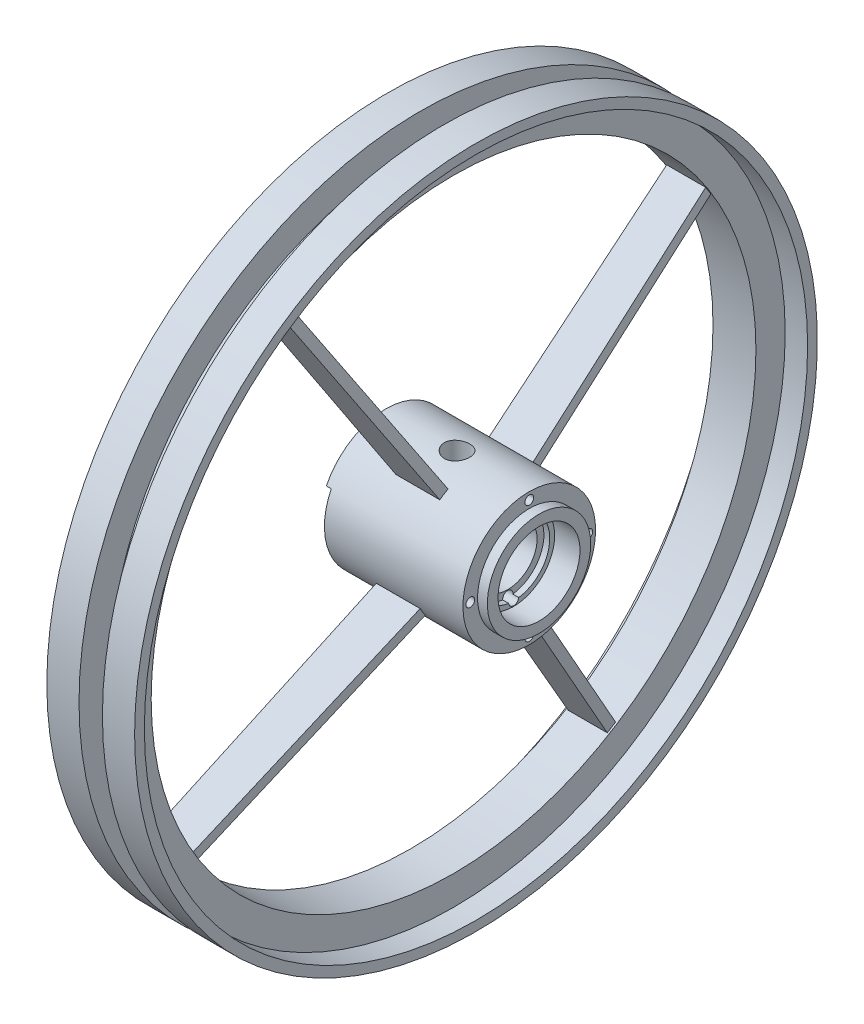
from build123d import *

# Parameters (mm, degrees)
SKETCH1_R                          = 68
BOSS_EXTRUDE1_DEPTH                = 157
CUT_EXTRUDE1_REACH                 = 186.111
SKETCH2_R                          = 26
SKETCH3_W                          = 136
SKETCH3_H                          = 98
CUT_EXTRUDE2_DEPTH                 = 5
CUT_EXTRUDE3_DEPTH                 = 44
SKETCH7_R                          = 42
CUT_EXTRUDE4_DEPTH                 = 26
SKETCH8_R                          = 37
CUT_EXTRUDE5_DEPTH                 = 6
SKETCH9_R                          = 30
CUT_EXTRUDE6_DEPTH                 = 28
CUT_EXTRUDE9_START                 = -10
SKETCH27_R                         = 68
SKETCH27_R_2                       = 53
CUT_EXTRUDE9_DEPTH                 = 10
TAP_DRILL_FOR_M1_2X0_25_TAP1_D     = 26
TAP_DRILL_FOR_M1_2X0_25_TAP1_DEPTH = 68
M8_CLEARANCE_HOLE1_D               = 9
M8_CLEARANCE_HOLE1_DEPTH           = 35
M8_CLEARANCE_HOLE1_TIP             = 2.703872786
BOSS_EXTRUDE4_DEPTH                = 5
CIRPATTERN4_COUNT                  = 4
M10_CLEARANCE_HOLE1_D              = 10.5
M10_CLEARANCE_HOLE1_DEPTH          = 15


with BuildPart() as part:
    # Sketch1 → Boss-Extrude1 (new body)
    with BuildSketch(Plane(origin=(0, 0, 0), x_dir=(0, 0, -1), z_dir=(1, 0, 0))):
        Circle(SKETCH1_R)
    extrude(amount=BOSS_EXTRUDE1_DEPTH)

    # Sketch2 → Cut-Extrude1 (cut, up to next)
    with BuildSketch(Plane.ZY, mode=Mode.PRIVATE) as cut_extrude1_sk1:
        Circle(SKETCH2_R)
    cut_extrude1_tool1 = extrude(cut_extrude1_sk1.sketch, amount=-CUT_EXTRUDE1_REACH, mode=Mode.PRIVATE) & part.part
    add(cut_extrude1_tool1.solids().sort_by_distance((0, 0, 0))[0], mode=Mode.SUBTRACT)

    # Sketch3 → Cut-Extrude2 (cut)
    with BuildSketch(Plane.ZY):
        with Locations((0, -19)):
            Rectangle(SKETCH3_W, SKETCH3_H)
    extrude(amount=-CUT_EXTRUDE2_DEPTH, mode=Mode.SUBTRACT)

    # Sketch4 → Cut-Extrude3 (cut)
    with BuildSketch(Plane.ZY.offset(-5)):
        with BuildLine():
            Line((-13.5, 29), (13.5, 29))
            ThreePointArc((13.5, 29), (0, -31.988279103), (-13.5, 29))
        make_face()
    extrude(amount=-CUT_EXTRUDE3_DEPTH, mode=Mode.SUBTRACT)

    # Sketch7 → Cut-Extrude4 (cut)
    with BuildSketch(Plane(origin=(157, 0, 0), x_dir=(0, 0, -1), z_dir=(1, 0, 0))):
        Circle(SKETCH7_R)
    extrude(amount=-CUT_EXTRUDE4_DEPTH, mode=Mode.SUBTRACT)

    # Sketch8 → Cut-Extrude5 (cut)
    with BuildSketch(Plane(origin=(131, 0, 0), x_dir=(0, 0, -1), z_dir=(1, 0, 0))):
        Circle(SKETCH8_R)
    extrude(amount=-CUT_EXTRUDE5_DEPTH, mode=Mode.SUBTRACT)

    # Sketch9 → Cut-Extrude6 (cut)
    with BuildSketch(Plane(origin=(125, 0, 0), x_dir=(0, 0, -1), z_dir=(1, 0, 0))):
        Circle(SKETCH9_R)
    extrude(amount=-CUT_EXTRUDE6_DEPTH, mode=Mode.SUBTRACT)

    # Sketch27 → Cut-Extrude9 (cut)
    with BuildSketch(Plane(origin=(157, 0, 0), x_dir=(0, 0, -1), z_dir=(1, 0, 0)).offset(CUT_EXTRUDE9_START)):
        Circle(SKETCH27_R)
        Circle(SKETCH27_R_2, mode=Mode.SUBTRACT)
    extrude(amount=CUT_EXTRUDE9_DEPTH, mode=Mode.SUBTRACT)

    # Sketch36 → Cut-Revolve2 (revolve, cut)
    with BuildSketch(Plane.XY):
        Polygon((49, 29), (60, 40), (86, 40), (97, 29), (97, 0), (49, 0), align=None)
    revolve(axis=Axis((0, 0, 0), (1, 0, 0)), mode=Mode.SUBTRACT)

    # Tap Drill for M1.2x0.25 Tap1
    with Locations(Plane(origin=(0, 68, 0), x_dir=(1, 0, 0), z_dir=(0, 1, 0))):
        with Locations((73, 0)):
            Hole(TAP_DRILL_FOR_M1_2X0_25_TAP1_D / 2, depth=TAP_DRILL_FOR_M1_2X0_25_TAP1_DEPTH)

    # M8 Clearance Hole1
    with Locations(Plane(origin=(147, 0, 0), x_dir=(0, 0, -1), z_dir=(1, 0, 0))):
        with Locations((-60.5, 0), (0, 60.5), (60.5, 0), (0, -60.5)):
            Hole(M8_CLEARANCE_HOLE1_D / 2, depth=M8_CLEARANCE_HOLE1_DEPTH)
            with Locations((0, 0, -(M8_CLEARANCE_HOLE1_DEPTH + M8_CLEARANCE_HOLE1_TIP / 2))):  # 118° drill point
                Cone(0, M8_CLEARANCE_HOLE1_D / 2, M8_CLEARANCE_HOLE1_TIP, mode=Mode.SUBTRACT)



with BuildPart() as body_2:
    # Sketch21 → Revolve1 (revolve)
    with BuildSketch(Plane(origin=(0, 0, 0), x_dir=(-1, 0, 0), z_dir=(0, 0.528534662230602, -0.8489117214532872))):
        Polygon((-67.368890821, 310), (-69.368890821, 310), (-69.368890821, 340), (-92.368890821, 340), (-92.368890821, 350), (-59.368890821, 350), (-59.368890821, 320), (-35.368890821, 320), (-35.368890821, 350), (-2.368890821, 350), (-2.368890821, 340), (-25.368890821, 340), (-25.368890821, 310), (-27.368890821, 310), align=None)
    revolve(axis=Axis((0, 0, 0), (1, 0, 0)))


with BuildPart() as part_1:
    add(part.part)

    add(body_2.part)  # Boss-Extrude4 merges body 2
    # Sketch19 → Boss-Extrude4 (add, symmetric)
    with BuildSketch(Plane(origin=(0, 0, 0), x_dir=(-1, 0, 0), z_dir=(0, 0.528534662230602, -0.8489117214532872))):
        Polygon((-27.368890821, 310), (-67.368890821, 310), (-95.5, 66.5), (-50.5, 66.5), align=None)
    boss_extrude4 = extrude(amount=BOSS_EXTRUDE4_DEPTH, both=True)

    # CirPattern4: Boss-Extrude4 ×4 about axis
    cirpattern4_axis = Axis((0, 0, 0), (1, 0, 0))
    for i in range(1, CIRPATTERN4_COUNT):
        add(boss_extrude4.rotate(cirpattern4_axis, i * 360 / CIRPATTERN4_COUNT))

    # M10 Clearance Hole1
    with Locations(Plane(origin=(131, 0, 0), x_dir=(0, 0, -1), z_dir=(1, 0, 0))):
        with Locations((0, -36)):
            Hole(M10_CLEARANCE_HOLE1_D / 2, depth=M10_CLEARANCE_HOLE1_DEPTH)


solid = part_1.part
